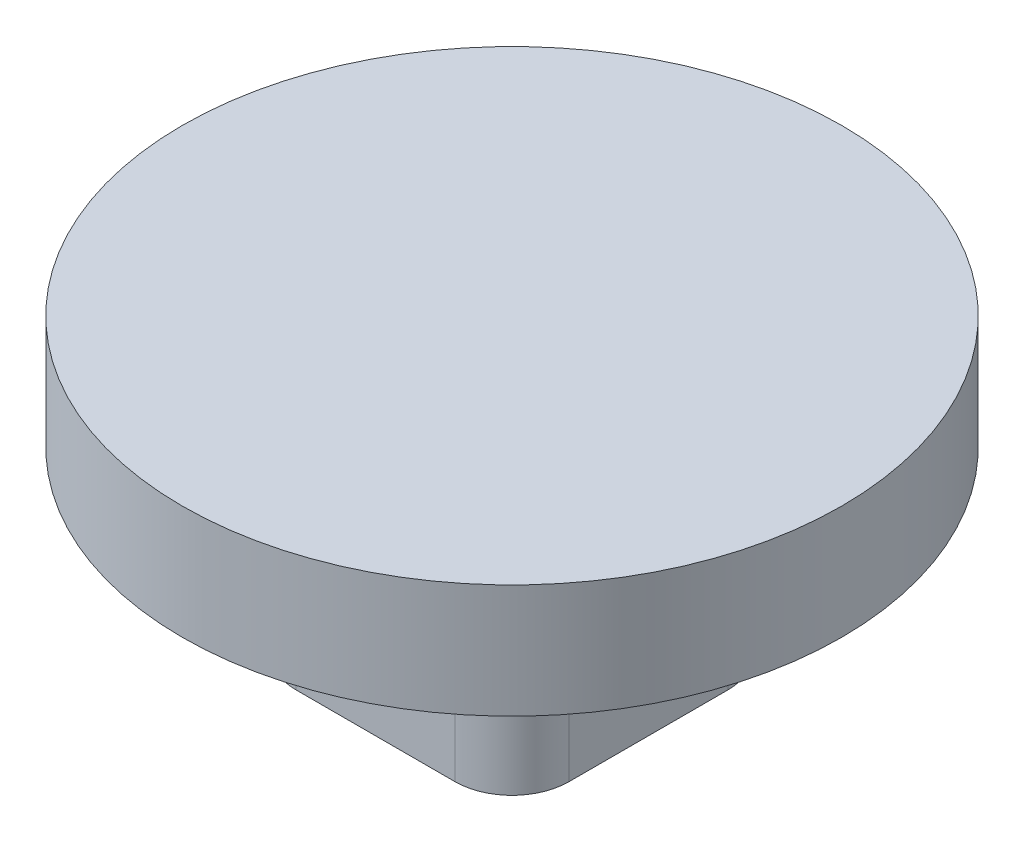
from build123d import *

# Parameters (mm, degrees)
SKETCH1_R           = 29
BOSS_EXTRUDE1_DEPTH = 10
SKETCH2_W           = 24
SKETCH2_H           = 24
SKETCH2_R           = 10
BOSS_EXTRUDE2_DEPTH = 16
SKETCH3_R           = 3
CUT_EXTRUDE1_DEPTH  = 53.706735812
FILLET1_R           = 5
FILLET2_R           = 2


with BuildPart() as part:
    # Sketch1 → Boss-Extrude1 (new body)
    with BuildSketch(Plane(origin=(0, 0, 0), x_dir=(1, 0, 0), z_dir=(0, 1, 0))):
        Circle(SKETCH1_R)
    extrude(amount=BOSS_EXTRUDE1_DEPTH)

    # Sketch2 → Boss-Extrude2 (add)
    with BuildSketch(Plane.XZ):
        Rectangle(SKETCH2_W, SKETCH2_H)
        Circle(SKETCH2_R, mode=Mode.SUBTRACT)
    extrude(amount=BOSS_EXTRUDE2_DEPTH)

    # Sketch3 → Cut-Extrude1 (cut, through all)
    with BuildSketch(Plane(origin=(12, 0, 0), x_dir=(0, 0, -1), z_dir=(1, 0, 0))):
        with Locations((0, -8)):
            Circle(SKETCH3_R)
    extrude(amount=-CUT_EXTRUDE1_DEPTH, mode=Mode.SUBTRACT)

    # Fillet1
    fillet1_edges = [part.edges().sort_by_distance(p)[0] for p in [
        (-12, -8, -12),
        (12, -8, -12),
        (12, -8, 12),
        (-12, -8, 12),
    ]]
    fillet(fillet1_edges, radius=FILLET1_R)

    # Fillet2
    fillet2_edges = [part.edges().sort_by_distance(p)[0] for p in [
        (-10.535533906, 0, 10.535533906),
        (0, 0, 12),
        (10.535533906, 0, 10.535533906),
        (12, 0, 0),
        (10.535533906, 0, -10.535533906),
        (0, 0, -12),
        (-10.535533906, 0, -10.535533906),
        (-12, 0, 0),
    ]]
    fillet(fillet2_edges, radius=FILLET2_R)


solid = part.part
